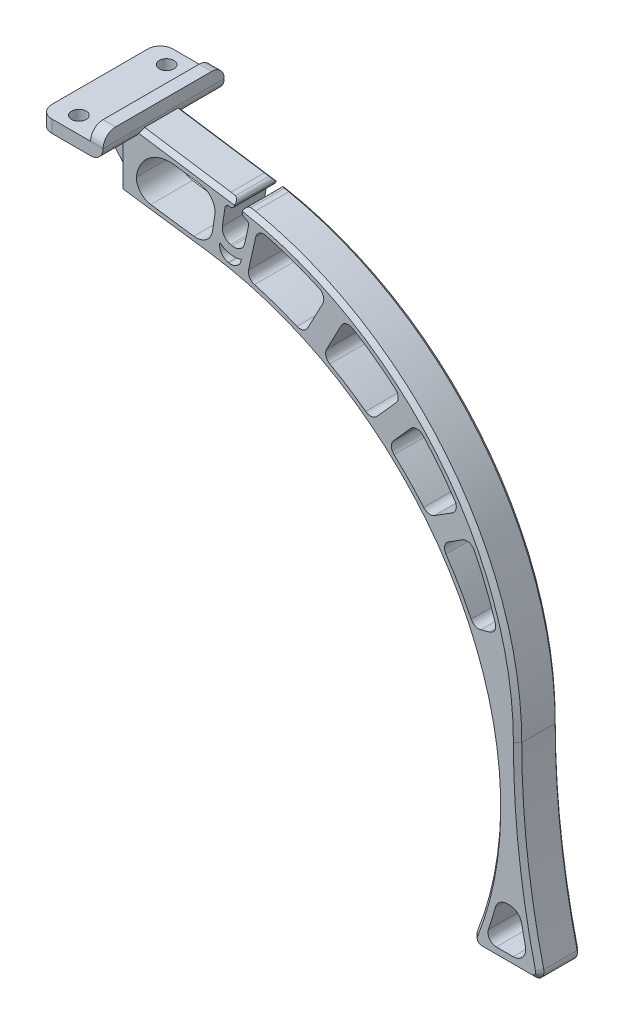
from build123d import *
from build123d.topology import SkipClean

# Parameters (mm, degrees)
SALIENTE_EXTRUIR1_DEPTH    = 10
CORTAR_EXTRUIR1_DEPTH      = 165.241593377
CORTAR_EXTRUIR2_DEPTH      = 165.241593377
REDONDEO1_R                = 2
REDONDEO2_R                = 2.5
REDONDEO3_R                = 2.5
SALIENTE_EXTRUIR2_START    = 10
CROQUIS4_W                 = 11
CROQUIS4_H                 = 3
SALIENTE_EXTRUIR2_DEPTH    = 29
CORTAR_EXTRUIR3_REACH      = 164.682
CROQUIS5_R                 = 1.75
REDONDEO4_R                = 3
SALIENTE_EXTRUIR3_START    = -5
SALIENTE_EXTRUIR3_DEPTH    = 2
REDONDEO6_R                = 1
SALIENTE_EXTRUIR6_DEPTH    = 10
CROQUIS7_W                 = 29
CROQUIS7_H                 = 3
SALIENTE_EXTRUIR4_DEPTH    = 4.3
CROQUIS8_W                 = 3
CROQUIS8_H                 = 29
SALIENTE_EXTRUIR5_DEPTH    = 3
REDONDEO8_R                = 3
REDONDEO9_START            = -10
REDONDEO9_DEPTH            = 10
REDONDEO9_START_2          = 10
REDONDEO9_2_DEPTH          = 9
REDONDEO9_START_3          = -7.17946
REDONDEO9_3_DEPTH          = 23.11648
CORTAR_EXTRUIR4_DEPTH      = 168.524031097
CORTAR_EXTRUIR4_DEPTH_BACK = 168.524031097
REDONDEO11_R               = 0.9
CORTAR_EXTRUIR5_DEPTH      = 168.524031097
REDONDEO12_R               = 3
REDONDEO13_R               = 2
REDONDEO14_R               = 4
CHAFL_N4_SIZE              = 1
REDONDEO20_R               = 8
REDONDEO21_R               = 0.8


with BuildPart() as part:
    # Croquis1 → Saliente-Extruir1 (new body)
    with BuildSketch(Plane.XY):
        with BuildLine():
            Line((0, 130), (26.401881141, 126.046330269))
            ThreePointArc((26.401881141, 126.046330269), (75.17331054, 99.132944214), (94.554022101, 46.908709476))
            ThreePointArc((94.554022101, 46.908709476), (95.872574467, 24.532507948), (99.820907964, 2.467974466))
            ThreePointArc((99.820907964, 2.467974466), (99.44740745, 0.76224981), (97.876428626, 0))
            Line((97.876428626, 0), (85.876428626, 0))
            ThreePointArc((85.876428626, 0), (84.224208665, 0.872982165), (84.014347262, 2.729830799))
            ThreePointArc((84.014347262, 2.729830799), (78.556592675, 72.364135387), (20.480662146, 111.170188443))
            Line((20.480662146, 111.170188443), (0, 114))
            Line((0, 114), (0, 130))
        make_face()
    extrude(amount=SALIENTE_EXTRUIR1_DEPTH)

    # Croquis2 → Cortar-Extruir1 (cut, through all)
    with BuildSketch(Plane.XY.offset(10)):
        with BuildLine():
            ThreePointArc((30.764753696, 125.268879152), (28.588701816, 125.687820679), (26.401881141, 126.046330269))
            Line((26.401881141, 126.046330269), (24.915903096, 126.268854808))
            Line((24.915903096, 126.268854808), (23.495219077, 116.78178756))
            ThreePointArc((23.495219077, 116.78178756), (26.078713677, 116.316049673), (28.646789734, 115.771677103))
            Line((28.646789734, 115.771677103), (30.764753696, 125.268879152))
        make_face()
        with BuildLine():
            Line((21.518109761, 117.083566645), (22.641761363, 124.587105904))
            Line((22.641761363, 124.587105904), (3.25775241, 127.489852456))
            Line((3.25775241, 127.489852456), (3.25775241, 115.568877265))
            Line((3.25775241, 115.568877265), (20.754401382, 113.151366585))
            ThreePointArc((20.754401382, 113.151366585), (20.8400534, 113.139486025), (20.925692843, 113.127515148))
            Line((20.925692843, 113.127515148), (21.221901588, 115.105542812))
            Line((21.221901588, 115.105542812), (21.518109761, 117.083566645))
        make_face()
        with BuildLine():
            Line((43.398960058, 106.602159978), (48.884633548, 117.006157037))
            ThreePointArc((48.884633548, 117.006157037), (40.754938969, 120.43347217), (32.290331975, 122.921212388))
            Line((32.290331975, 122.921212388), (29.720708564, 111.398715709))
            ThreePointArc((29.720708564, 111.398715709), (36.666026085, 109.30326301), (43.398960058, 106.602159978))
        make_face()
        with BuildLine():
            ThreePointArc((22.902761372, 112.825463695), (25.346699836, 112.383404364), (27.776129876, 111.867534856))
            Line((27.776129876, 111.867534856), (28.211459927, 113.819606524))
            ThreePointArc((28.211459927, 113.819606524), (25.71270716, 114.34972928), (23.198990997, 114.803630786))
            Line((23.198990997, 114.803630786), (22.902761372, 112.825463695))
        make_face()
    extrude(amount=-CORTAR_EXTRUIR1_DEPTH, mode=Mode.SUBTRACT)

    # Croquis3 → Cortar-Extruir2 (cut, through all)
    with BuildSketch(Plane.XY.offset(10)):
        with BuildLine():
            Line((53.28566019, 114.632730098), (47.889338815, 104.398196122))
            ThreePointArc((47.889338815, 104.398196122), (53.923670704, 100.867235968), (59.635285973, 96.835078734))
            Line((59.635285973, 96.835078734), (66.793520379, 104.851182133))
            ThreePointArc((66.793520379, 104.851182133), (60.301771602, 110.104016251), (53.28566019, 114.632730098))
        make_face()
        with BuildLine():
            Line((73.17933027, 83.623177422), (80.649917111, 88.345096169))
            ThreePointArc((80.649917111, 88.345096169), (75.86687037, 95.144022679), (70.387423602, 101.395310621))
            Line((70.387423602, 101.395310621), (63.501543927, 93.65790216))
            ThreePointArc((63.501543927, 93.65790216), (68.554079017, 88.846582397), (73.17933027, 83.623177422))
        make_face()
        with BuildLine():
            ThreePointArc((84.127046828, 65.973666719), (80.504501026, 72.993433012), (76.22330894, 79.632058714))
            Line((76.22330894, 79.632058714), (83.158207375, 84.042747934))
            ThreePointArc((83.158207375, 84.042747934), (86.942016291, 75.979828199), (89.781974737, 67.538115069))
            Line((89.781974737, 67.538115069), (84.127046828, 65.973666719))
        make_face()
    extrude(amount=-CORTAR_EXTRUIR2_DEPTH, mode=Mode.SUBTRACT)

    # Redondeo1
    redondeo1_edges = [part.edges().sort_by_distance(p)[0] for p in [
        (80.649917111, 88.345096169, 5),
        (73.17933027, 83.623177422, 5),
        (63.501543927, 93.65790216, 5),
        (70.387423602, 101.395310621, 5),
        (84.127046828, 65.973666719, 5),
        (76.22330894, 79.632058714, 5),
        (83.158207375, 84.042747934, 5),
        (89.781974737, 67.538115069, 5),
        (48.884633548, 117.006157037, 5),
        (43.398960058, 106.602159978, 5),
        (29.720708564, 111.398715709, 5),
        (32.290331975, 122.921212388, 5),
        (59.635285973, 96.835078734, 5),
        (47.889338815, 104.398196122, 5),
        (53.28566019, 114.632730098, 5),
        (66.793520379, 104.851182133, 5),
    ]]
    fillet(redondeo1_edges, radius=REDONDEO1_R)

    # Redondeo2
    redondeo2_edges = [part.edges().sort_by_distance(p)[0] for p in [
        (28.646789734, 115.771677103, 5),
        (23.495219077, 116.78178756, 5),
    ]]
    fillet(redondeo2_edges, radius=REDONDEO2_R)

    # Redondeo3
    # the kernel refuses this fillet: 2.5 mm, written as the material it adds along each edge
    with BuildSketch(Plane(origin=(22.902761372, 112.825463695, 10), x_dir=(0.9841718319713948, -0.1772168308995186, 0), z_dir=(0, 0, -1))) as redondeo3_piece_1:
        with BuildLine():
            CenterArc((2.390386628, -2.499742344), REDONDEO3_R, 90.822605228, 77.631333277)
            Line((-0.05902365, -1.999353205), (-0.108011856, -1.989345422))
            ThreePointArc((-0.108011856, -1.989345422), (-0.079490052, -0.998201177), (-0.049978226, 0.001475426))
            Line((-0.049978226, 0.001475426), (0.000717834, 0.049994847))
            ThreePointArc((0.000717834, 0.049994847), (1.177247468, 0.041548884), (2.353777103, 0.049994847))
            Line((2.353777103, 0.049994847), (2.354494937, 0))
        make_face()
    extrude(amount=10)
    with BuildSketch(Plane(origin=(27.776129876, 111.867534856, 10), x_dir=(-0.9780763739083984, 0.20824650489791874, 0), z_dir=(0, 0, -1))) as redondeo3_piece_2:
        with BuildLine():
            CenterArc((2.430256107, 2.499733677), REDONDEO3_R, 191.53234022, 77.631333277)
            Line((-0.019273935, 1.999931141), (-0.068264536, 1.98993509))
            ThreePointArc((-0.068264536, 1.98993509), (-0.059634646, 0.999483728), (-0.049997678, -0.000481843))
            Line((-0.049997678, -0.000481843), (0.000729807, -0.049994674))
            ThreePointArc((0.000729807, -0.049994674), (1.196882887, -0.041264604), (2.393035968, -0.049994674))
            Line((2.393035968, -0.049994674), (2.393765775, 0))
        make_face()
    extrude(amount=10)

    # Croquis4 → Saliente-Extruir2 (add)
    with BuildSketch(Plane(origin=(0, 0, 0), x_dir=(-1, 0, 0), z_dir=(0, 0, -1)).offset(SALIENTE_EXTRUIR2_START)):
        with Locations((5.5, 128.5)):
            Rectangle(CROQUIS4_W, CROQUIS4_H)
    extrude(amount=-SALIENTE_EXTRUIR2_DEPTH)

    # Croquis5 → Cortar-Extruir3 (cut, up to next)
    with BuildSketch(Plane.XZ.offset(-127), mode=Mode.PRIVATE) as cortar_extruir3_sk1:
        with Locations(Location((-5.5, -6, 0), (0, 0, 270))):
            Circle(CROQUIS5_R)
    cortar_extruir3_tool1 = extrude(cortar_extruir3_sk1.sketch, amount=-CORTAR_EXTRUIR3_REACH, mode=Mode.PRIVATE) & part.part
    # Croquis5 → Cortar-Extruir3 (cut, up to next)
    with BuildSketch(Plane.XZ.offset(-127), mode=Mode.PRIVATE) as cortar_extruir3_sk2:
        with Locations(Location((-5.5, 15, 0), (0, 0, 270))):
            Circle(CROQUIS5_R)
    cortar_extruir3_tool2 = extrude(cortar_extruir3_sk2.sketch, amount=-CORTAR_EXTRUIR3_REACH, mode=Mode.PRIVATE) & part.part
    add(cortar_extruir3_tool1.solids().sort_by_distance((-5.5, 127, -6))[0], mode=Mode.SUBTRACT)
    add(cortar_extruir3_tool2.solids().sort_by_distance((-5.5, 127, 15))[0], mode=Mode.SUBTRACT)

    # Redondeo4
    redondeo4_edges = [part.edges().sort_by_distance(p)[0] for p in [
        (-11, 128.5, 19),
        (-11, 128.5, -10),
    ]]
    fillet(redondeo4_edges, radius=REDONDEO4_R)

    # Croquis6 → Saliente-Extruir3 (add, symmetric)
    with BuildSketch(Plane.XY.offset(10).offset(SALIENTE_EXTRUIR3_START)):
        Polygon((0, 127), (0, 114), (-11, 127), align=None)
    extrude(amount=SALIENTE_EXTRUIR3_DEPTH, both=True)

    # Redondeo6
    # the kernel refuses this fillet: 1 mm, written as the material it adds along each edge
    with BuildSketch(Plane(origin=(-11, 127, 7), x_dir=(0, 0, 1), z_dir=(1, 0, 0))) as redondeo6_piece_1_section:
        with BuildLine():
            CenterArc((REDONDEO6_R, REDONDEO6_R), REDONDEO6_R, 180, 90)
            Line((0, REDONDEO6_R), (0, 0))
            Line((0, 0), (REDONDEO6_R, 0))
        make_face()
    redondeo6_piece_1 = extrude(amount=13.5, mode=Mode.PRIVATE)
    redondeo6_piece_1 = split(redondeo6_piece_1, bisect_by=Plane(origin=(-11, 127, 7), z_dir=(0.7633862853691146, 0.6459422414661738, 0)), keep=Keep.TOP, mode=Mode.PRIVATE)
    add(redondeo6_piece_1)

    # Croquis10 → Saliente-Extruir6 (add)
    with BuildSketch(Plane.XY.offset(10)):
        Polygon((24.619706681, 124.290909489), (26.560342696, 123.967838311), (26.887298092, 125.931806191), (24.915903096, 126.268854808), (24.11575151, 125.328739967), align=None)
        Polygon((28.467790445, 123.650292215), (30.33449089, 123.339529606), (31.190262594, 124.1347795), (30.764753696, 125.268879152), (28.7933587, 125.605927769), align=None)
    extrude(amount=-SALIENTE_EXTRUIR6_DEPTH)

    # Croquis7 → Saliente-Extruir4 (add)
    with BuildSketch(Plane(origin=(0, 0, 0), x_dir=(0, 0, -1), z_dir=(1, 0, 0))):
        with Locations((-4.5, 128.5)):
            Rectangle(CROQUIS7_W, CROQUIS7_H)
    extrude(amount=SALIENTE_EXTRUIR4_DEPTH)

    # Croquis8 → Saliente-Extruir5 (add)
    with BuildSketch(Plane(origin=(0, 130, 0), x_dir=(1, 0, 0), z_dir=(0, 1, 0))):
        with Locations((2.8, -4.5)):
            Rectangle(CROQUIS8_W, CROQUIS8_H)
    extrude(amount=SALIENTE_EXTRUIR5_DEPTH)

    # Redondeo8
    redondeo8_edges = [part.edges().sort_by_distance(p)[0] for p in [
        (2.8, 133, -10),
        (2.8, 133, 19),
    ]]
    fillet(redondeo8_edges, radius=REDONDEO8_R)

    # Redondeo9: read off the stored shape, not the designer's step
    # Redondeo9 outline → Redondeo9 (cut)
    with BuildSketch(Plane.XY.offset(REDONDEO9_START)):
        with BuildLine():
            Line((1.3, 127), (4.3, 127))
            Line((4.3, 127), (4.3, 130))
            ThreePointArc((4.3, 130), (3.421320344, 127.878679656), (1.3, 127))
        make_face()
    extrude(amount=REDONDEO9_DEPTH, mode=Mode.SUBTRACT)

    # Redondeo9 2 outline → Redondeo9 2 (cut)
    with BuildSketch(Plane.XY.offset(REDONDEO9_START_2)):
        with BuildLine():
            Line((1.3, 127), (4.3, 127))
            Line((4.3, 127), (4.3, 130))
            ThreePointArc((4.3, 130), (3.421320344, 127.878679656), (1.3, 127))
        make_face()
    extrude(amount=REDONDEO9_2_DEPTH, mode=Mode.SUBTRACT)

    # Redondeo9 3 outline → Redondeo9 3 (cut)
    with BuildSketch(Plane.XY.offset(REDONDEO9_START_3)):
        with BuildLine():
            ThreePointArc((4.3, 130), (4.283024215, 129.681304956), (4.232288979, 129.366216644))
            Line((4.232288979, 129.366216644), (4.3, 129.356076949))
            Line((4.3, 129.356076949), (4.3, 130))
        make_face()
        Polygon((3.25775241, 127.489852456), (3.25775241, 127), (4.3, 127), (4.3, 127.333776352), align=None)
    extrude(amount=REDONDEO9_3_DEPTH, mode=Mode.SUBTRACT)

    # Croquis9 → Cortar-Extruir4 (cut, two sides: drawn at the far end of the back side and taken through both)
    with SkipClean():  # the faces are left unmerged after this step: merging them gives an invalid solid
        with BuildSketch(Plane.XY.offset(10).offset(-CORTAR_EXTRUIR4_DEPTH_BACK)):
            with BuildLine():
                ThreePointArc((25.473445581, 114.396339552), (24.300676641, 114.796841727), (23.281624901, 115.502052708))
                ThreePointArc((23.281624901, 115.502052708), (23.215625479, 115.155762057), (23.198990997, 114.803630786))
                ThreePointArc((23.198990997, 114.803630786), (24.337618803, 114.607806122), (25.473445581, 114.396339552))
            make_face()
            with BuildLine():
                ThreePointArc((28.40523152, 114.549846597), (27.154498478, 114.251271835), (25.870386119, 114.318617802))
                ThreePointArc((25.870386119, 114.318617802), (27.042700593, 114.0774515), (28.211459927, 113.819606524))
                ThreePointArc((28.211459927, 113.819606524), (28.33609025, 114.17736446), (28.40523152, 114.549846597))
            make_face()
        extrude(amount=CORTAR_EXTRUIR4_DEPTH + CORTAR_EXTRUIR4_DEPTH_BACK, mode=Mode.SUBTRACT)

    # Redondeo11
    redondeo11_edges = [part.edges().sort_by_distance(p)[0] for p in [
        (30.33449089, 123.339529606, 5),
        (28.467790445, 123.650292215, 5),
        (28.7933587, 125.605927769, 5),
        (26.887298092, 125.931806191, 5),
        (26.560342696, 123.967838311, 5),
        (24.619706681, 124.290909489, 5),
    ]]
    fillet(redondeo11_edges, radius=REDONDEO11_R)

    # Croquis11 → Cortar-Extruir5 (cut, through all)
    with SkipClean():  # the faces are left unmerged after this step: merging them gives an invalid solid
        with BuildSketch(Plane.XY.offset(10)):
            with BuildLine():
                ThreePointArc((95.102226876, 12.764712517), (96.10255819, 7.617757487), (97.242894604, 2.5))
                Line((97.242894604, 2.5), (86.605948395, 2.5))
                ThreePointArc((86.605948395, 2.5), (88.358116265, 7.580705469), (89.775766159, 12.764712517))
                Line((89.775766159, 12.764712517), (95.102226876, 12.764712517))
            make_face()
        extrude(amount=-CORTAR_EXTRUIR5_DEPTH, mode=Mode.SUBTRACT)

    # Redondeo12
    redondeo12_edges = [part.edges().sort_by_distance(p)[0] for p in [
        (95.102226876, 12.764712517, 5),
        (97.242894604, 2.5, 5),
        (89.775766159, 12.764712517, 5),
    ]]
    fillet(redondeo12_edges, radius=REDONDEO12_R)

    # Redondeo13
    redondeo13_edges = [part.edges().sort_by_distance(p)[0] for p in [
        (86.605948395, 2.5, 5),
    ]]
    fillet(redondeo13_edges, radius=REDONDEO13_R)

    # Redondeo14
    redondeo14_edges = [part.edges().sort_by_distance(p)[0] for p in [
        (20.925692843, 113.127515148, 5),
        (3.25775241, 115.568877265, 5),
        (22.641761363, 124.587105904, 5),
    ]]
    fillet(redondeo14_edges, radius=REDONDEO14_R)

    # Chaflán4
    # the kernel refuses this chamfer: 1 mm, written as the material it takes off along each edge
    with BuildSketch(Plane(origin=(4.3, 129.35607695, 10), x_dir=(-0.1480982073520025, -0.9889726593688642, 0), z_dir=(0.9889726593688641, -0.14809820735200246, 0)), Plane(origin=(4.3, 129.35607695, 0), x_dir=(0, 0, 1), z_dir=(0.9889726593688641, -0.14809820735200246, 0))) as chafl_n4_piece_1:
        Polygon((CHAFL_N4_SIZE, 0), (0, CHAFL_N4_SIZE), (0, 0), align=None)
    extrude(amount=23.417459563, mode=Mode.SUBTRACT)
    with BuildSketch(Plane(origin=(20.480662146, 111.170188443, 0), x_dir=(0, 0, 1), z_dir=(-0.9905890710592217, 0.13686961787784868, 0)), Plane(origin=(20.480662146, 111.170188443, 10), x_dir=(0.13686961787784868, 0.9905890710592217, 0), z_dir=(-0.9905890710592217, 0.13686961787784868, 0))) as chafl_n4_piece_2:
        Polygon((CHAFL_N4_SIZE, 0), (0, CHAFL_N4_SIZE), (0, 0), align=None)
    extrude(amount=23.246918304, mode=Mode.SUBTRACT)
    with BuildSketch(Plane(origin=(9.531092716, 31.923062758, 0), x_dir=(0.9310406818270486, -0.36491539948736684, 0), z_dir=(-0.36491539948736684, -0.9310406818270486, 0))) as chafl_n4_piece_3:
        Polygon((80, CHAFL_N4_SIZE), (80 + CHAFL_N4_SIZE, 0), (80, 0), align=None)
    revolve(axis=Axis((9.531092716, 31.923062758, 0), (0, 0, 1)), revolution_arc=103.53563158, mode=Mode.SUBTRACT)
    with BuildSketch(Plane(origin=(9.531092716, 31.923062758, 10), x_dir=(0.9310406818270486, -0.36491539948736684, 0), z_dir=(-0.36491539948736684, -0.9310406818270486, 0))) as chafl_n4_piece_4:
        Polygon((80 + CHAFL_N4_SIZE, 0), (80, -CHAFL_N4_SIZE), (80, 0), align=None)
    revolve(axis=Axis((9.531092716, 31.923062758, 10), (0, 0, 1)), revolution_arc=103.53563158, mode=Mode.SUBTRACT)
    with BuildSketch(Plane(origin=(85.876428626, 2, 0), x_dir=(0, -1, 0), z_dir=(1, 0, 0))) as chafl_n4_piece_5:
        Polygon((2, -CHAFL_N4_SIZE), (2 - CHAFL_N4_SIZE, 0), (2, 0), align=None)
    revolve(axis=Axis((85.876428626, 2, 0), (0, 0, -1)), revolution_arc=111.402376338, mode=Mode.SUBTRACT)
    with BuildSketch(Plane(origin=(85.876428626, 2, 10), x_dir=(0, -1, 0), z_dir=(1, 0, 0))) as chafl_n4_piece_6:
        Polygon((2 - CHAFL_N4_SIZE, 0), (2, CHAFL_N4_SIZE), (2, 0), align=None)
    revolve(axis=Axis((85.876428626, 2, 10), (0, 0, -1)), revolution_arc=111.402376338, mode=Mode.SUBTRACT)
    with BuildSketch(Plane(origin=(97.876428626, 0, 0), x_dir=(0, 0, 1), z_dir=(-1, 0, 0)), Plane(origin=(97.876428626, 0, 10), x_dir=(0, 1, 0), z_dir=(-1, 0, 0))) as chafl_n4_piece_7:
        Polygon((CHAFL_N4_SIZE, 0), (0, CHAFL_N4_SIZE), (0, 0), align=None)
    extrude(amount=12, mode=Mode.SUBTRACT)
    with BuildSketch(Plane(origin=(97.876428626, 2, 0), x_dir=(0.9722396693841707, 0.23398723314693645, 0), z_dir=(-0.23398723314693645, 0.9722396693841707, 0))) as chafl_n4_piece_8:
        Polygon((2, -CHAFL_N4_SIZE), (2 - CHAFL_N4_SIZE, 0), (2, 0), align=None)
    revolve(axis=Axis((97.876428626, 2, 0), (0, 0, -1)), revolution_arc=103.531931163, mode=Mode.SUBTRACT)
    with BuildSketch(Plane(origin=(97.876428626, 2, 10), x_dir=(0.9722396693841707, 0.23398723314693645, 0), z_dir=(-0.23398723314693645, 0.9722396693841707, 0))) as chafl_n4_piece_9:
        Polygon((2 - CHAFL_N4_SIZE, 0), (2, CHAFL_N4_SIZE), (2, 0), align=None)
    revolve(axis=Axis((97.876428626, 2, 10), (0, 0, -1)), revolution_arc=103.531931163, mode=Mode.SUBTRACT)
    with BuildSketch(Plane(origin=(284.281284032, 46.861732899, 0), x_dir=(-0.9999999693469824, 0.00024760055430921273, 0), z_dir=(0.00024760055430921273, 0.9999999693469824, 0))) as chafl_n4_piece_10:
        Polygon((189.727267747, CHAFL_N4_SIZE), (189.727267747 + CHAFL_N4_SIZE, 0), (189.727267747, 0), align=None)
    revolve(axis=Axis((284.281284032, 46.861732899, 0), (0, 0, 1)), revolution_arc=13.54611763, mode=Mode.SUBTRACT)
    with BuildSketch(Plane(origin=(284.281284032, 46.861732899, 10), x_dir=(-0.9999999693469824, 0.00024760055430921273, 0), z_dir=(0.00024760055430921273, 0.9999999693469824, 0))) as chafl_n4_piece_11:
        Polygon((189.727267747 + CHAFL_N4_SIZE, 0), (189.727267747, -CHAFL_N4_SIZE), (189.727267747, 0), align=None)
    revolve(axis=Axis((284.281284032, 46.861732899, 10), (0, 0, 1)), revolution_arc=13.54611763, mode=Mode.SUBTRACT)
    with BuildSketch(Plane(origin=(14.554024553, 46.92851752, 10), x_dir=(0.1710460593691773, 0.9852630336992634, 0), z_dir=(-0.9852630336992634, 0.1710460593691773, 0))) as chafl_n4_piece_12:
        Polygon((80 - CHAFL_N4_SIZE, 0), (80, CHAFL_N4_SIZE), (80, 0), align=None)
    revolve(axis=Axis((14.554024553, 46.92851752, 10), (0, 0, -1)), revolution_arc=80.165541749, mode=Mode.SUBTRACT)
    with BuildSketch(Plane(origin=(14.554024553, 46.92851752, 0), x_dir=(0.17104605936915773, 0.9852630336992668, 0), z_dir=(-0.9852630336992668, 0.17104605936915773, 0))) as chafl_n4_piece_13:
        Polygon((80, -CHAFL_N4_SIZE), (80 - CHAFL_N4_SIZE, 0), (80, 0), align=None)
    revolve(axis=Axis((14.554024553, 46.92851752, 0), (0, 0, -1)), revolution_arc=80.165541749, mode=Mode.SUBTRACT)
    with BuildSketch(Plane(origin=(4.3, 129.356076949, 0), x_dir=(0, 0, 1), z_dir=(-0.9889726587172163, 0.14809821170358792, 0))) as chafl_n4_piece_14_section:
        Polygon((CHAFL_N4_SIZE, 0), (0, -CHAFL_N4_SIZE), (0, 0), align=None)
    chafl_n4_piece_14 = extrude(amount=2.640149007, mode=Mode.PRIVATE)
    chafl_n4_piece_14 = chafl_n4_piece_14 - Plane(origin=(1.300000002, 129.999999998, 0), x_dir=(1.0, 5.011505287343242e-10, 0), z_dir=(0, 0, -1)) * Cylinder(2.999999998, 10, mode=Mode.PRIVATE)
    add(chafl_n4_piece_14, mode=Mode.SUBTRACT)
    with BuildSketch(Plane(origin=(4.3, 129.356076949, 10), x_dir=(-0.14809821170358792, -0.9889726587172163, -1.7763568394002505e-15), z_dir=(-0.9889726587172163, 0.14809821170358792, 0))) as chafl_n4_piece_15_section:
        Polygon((CHAFL_N4_SIZE, 0), (0, -CHAFL_N4_SIZE), (0, 0), align=None)
    chafl_n4_piece_15 = extrude(amount=2.640149007, mode=Mode.PRIVATE)
    chafl_n4_piece_15 = chafl_n4_piece_15 - Plane(origin=(1.300000002, 129.999999998, 10), x_dir=(1.0, 5.011505287343242e-10, 0), z_dir=(0, 0, -1)) * Cylinder(2.999999998, 10, mode=Mode.PRIVATE)
    add(chafl_n4_piece_15, mode=Mode.SUBTRACT)

    # Redondeo20
    # the kernel refuses this fillet: 8 mm, written as the material it adds along each edge
    with BuildSketch(Plane(origin=(3.25775241, 127.489852456, 0), x_dir=(-1.166945491868582e-11, -1.0, 0), z_dir=(0, 0, 1))) as redondeo20_piece_1:
        with BuildLine():
            CenterArc((9.280499658, 7.955264612), REDONDEO20_R, 171.483269063, 92.454662622)
            Line((1.368718383, 9.14005027), (0, 0))
            Line((0, 0), (8.435653548, 0))
        make_face()
    extrude(amount=10)

    # Redondeo21
    # the kernel refuses this fillet: 0.8 mm, written as the material it adds along each edge
    with BuildSketch(Plane(origin=(-11, 127, 3), x_dir=(0, 0, -1), z_dir=(1, 0, 0))) as redondeo21_piece_1_section:
        with BuildLine():
            CenterArc((REDONDEO21_R, -REDONDEO21_R), REDONDEO21_R, 90, 90)
            Line((0, -REDONDEO21_R), (0, 0))
            Line((0, 0), (REDONDEO21_R, 0))
        make_face()
    redondeo21_piece_1 = extrude(amount=13, mode=Mode.PRIVATE)
    redondeo21_piece_1 = split(redondeo21_piece_1, bisect_by=Plane(origin=(-11, 127, 3), z_dir=(0.7633862853691524, 0.645942241466129, 0)), keep=Keep.TOP, mode=Mode.PRIVATE)
    add(redondeo21_piece_1)


solid = part.part
